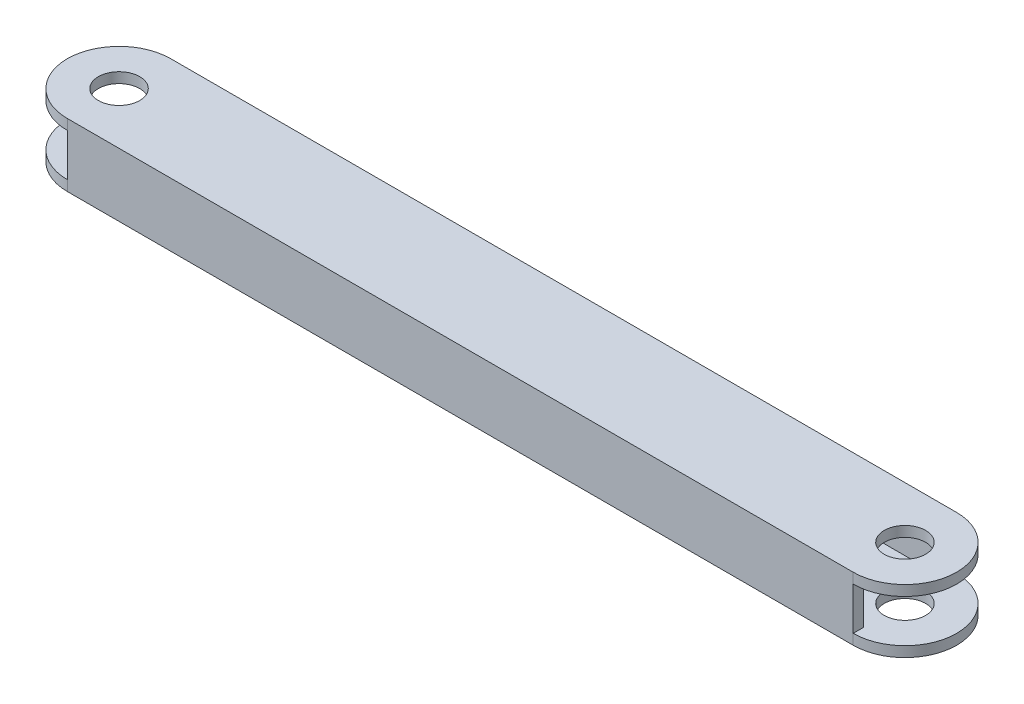
from build123d import *

# Parameters (mm, degrees)
SKETCH1_W           = 85.948776221
SKETCH1_H           = 6.116753323
BOSS_EXTRUDE3_DEPTH = 10
FILLET1_RADIUS      = 5
FILLET1_LENGTH      = 6.116753323
FILLET2_RADIUS      = 5
FILLET2_LENGTH      = 6.116753323
SKETCH2_R           = 2
CUT_EXTRUDE1_DEPTH  = 10
SHELL4_START        = -36.984014516
SHELL4_OUTLINE_W    = 4.116753323
SHELL4_OUTLINE_H    = 8
SHELL4_DEPTH        = 85.948776221
SHELL4_START_2      = -36.983829274
SHELL4_2_OUTLINE_W  = 4.116753323
SHELL4_2_OUTLINE_H  = 2
SHELL4_2_DEPTH      = 4.999814758
SHELL4_START_3      = 43.964761705
SHELL4_3_OUTLINE_W  = 4.116753323
SHELL4_3_OUTLINE_H  = 2
SHELL4_3_DEPTH      = 4.999814758


# Read off the part's stored shape, not the designer's step: Shell4
with BuildPart() as part:
    # Sketch1 → Boss-Extrude3 (new body)
    with BuildSketch(Plane.XY):
        with Locations((5.990373594, 3.058376662)):
            Rectangle(SKETCH1_W, SKETCH1_H)
    extrude(amount=BOSS_EXTRUDE3_DEPTH)

    # Fillet1: full round fillet: the end face becomes a half cylinder, R = half its width
    fillet1_face = Plane((48.964761705, 3.058376662, 5), x_dir=(0, -1, 0), z_dir=(1, 0, 0))  # on the end face: x along it, z out of the body
    fillet1_slab = fillet1_face.offset(-FILLET1_RADIUS / 2) * Box(FILLET1_LENGTH, 2 * FILLET1_RADIUS, FILLET1_RADIUS, mode=Mode.PRIVATE)  # the body's end, R deep
    fillet1_round = Plane((43.964761705, 3.058376662, 5), x_dir=(1, 0, 0), z_dir=(0, -1, 0)) * Cylinder(FILLET1_RADIUS, FILLET1_LENGTH, mode=Mode.PRIVATE)  # its axis R under the face
    add(fillet1_slab - fillet1_round, mode=Mode.SUBTRACT)

    # Fillet2: full round fillet: the end face becomes a half cylinder, R = half its width
    fillet2_face = Plane((-36.984014516, 3.058376662, 5), x_dir=(0, 1, 0), z_dir=(-1, 0, 0))  # on the end face: x along it, z out of the body
    fillet2_slab = fillet2_face.offset(-FILLET2_RADIUS / 2) * Box(FILLET2_LENGTH, 2 * FILLET2_RADIUS, FILLET2_RADIUS, mode=Mode.PRIVATE)  # the body's end, R deep
    fillet2_round = Plane((-31.984014516, 3.058376662, 5), x_dir=(-1, 0, 0), z_dir=(0, 1, 0)) * Cylinder(FILLET2_RADIUS, FILLET2_LENGTH, mode=Mode.PRIVATE)  # its axis R under the face
    add(fillet2_slab - fillet2_round, mode=Mode.SUBTRACT)

    # Sketch2 → Cut-Extrude1 (cut)
    with BuildSketch(Plane(origin=(0, 6.116753323, 0), x_dir=(1, 0, 0), z_dir=(0, 1, 0))):
        with Locations(Location((43.964761705, -5, 0), (0, 0, 270))):
            Circle(SKETCH2_R)
        with Locations(Location((-31.984014516, -5, 0), (0, 0, 270))):
            Circle(SKETCH2_R)
    extrude(amount=-CUT_EXTRUDE1_DEPTH, mode=Mode.SUBTRACT)

    # Shell4 outline → Shell4 (cut)
    with BuildSketch(Plane.YZ.offset(SHELL4_START)):
        with Locations((3.058376662, 5)):
            Rectangle(SHELL4_OUTLINE_W, SHELL4_OUTLINE_H)
    extrude(amount=SHELL4_DEPTH, mode=Mode.SUBTRACT)

    # Shell4 2 outline → Shell4 2 (cut)
    with BuildSketch(Plane.YZ.offset(SHELL4_START_2)):
        with Locations((3.058376662, 0)):
            Rectangle(SHELL4_2_OUTLINE_W, SHELL4_2_OUTLINE_H)
        with Locations((3.058376662, 10)):
            Rectangle(SHELL4_2_OUTLINE_W, SHELL4_2_OUTLINE_H)
    extrude(amount=SHELL4_2_DEPTH, mode=Mode.SUBTRACT)

    # Shell4 3 outline → Shell4 3 (cut)
    with BuildSketch(Plane.YZ.offset(SHELL4_START_3)):
        with Locations((3.058376662, 0)):
            Rectangle(SHELL4_3_OUTLINE_W, SHELL4_3_OUTLINE_H)
        with Locations((3.058376662, 10)):
            Rectangle(SHELL4_3_OUTLINE_W, SHELL4_3_OUTLINE_H)
    extrude(amount=SHELL4_3_DEPTH, mode=Mode.SUBTRACT)


solid = part.part
